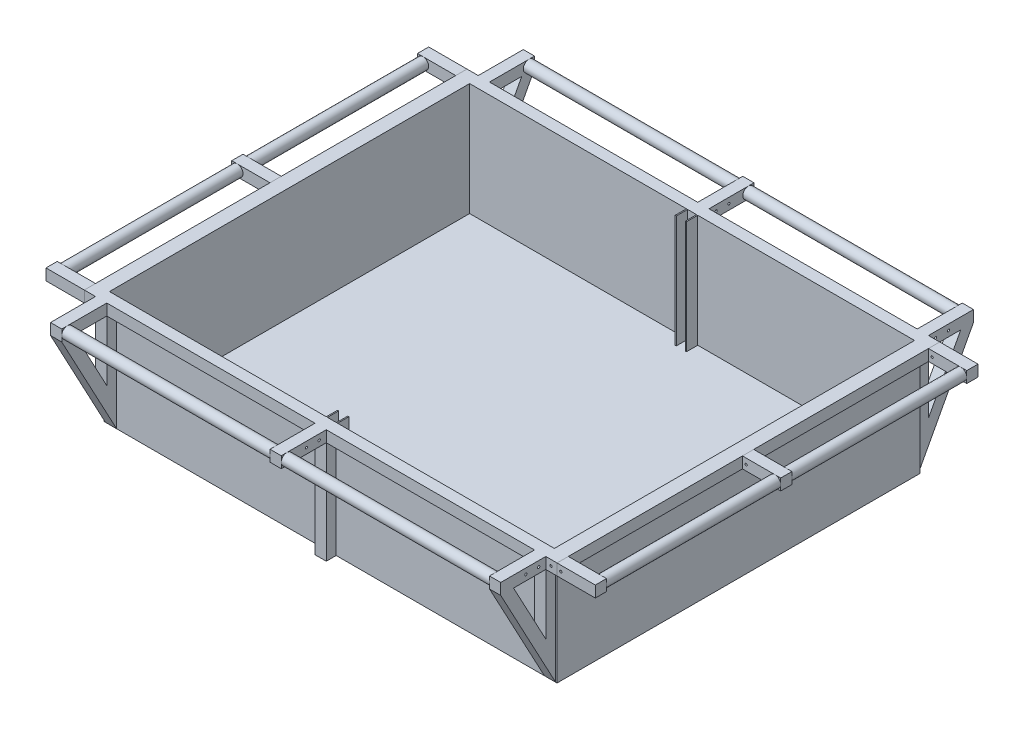
from build123d import *

# Parameters (mm, degrees)
SKETCH1_W            = 1050
SKETCH1_H            = 850
BOSS_EXTRUDE2_DEPTH  = 3
SKETCH2_W            = 1050
SKETCH2_H            = 850
SKETCH2_W_2          = 988.235294118
SKETCH2_H_2          = 800
BOSS_EXTRUDE4_DEPTH  = 250
SKETCH3_W            = 1050
SKETCH3_H            = 850
SKETCH3_W_2          = 1006
SKETCH3_H_2          = 806
CUT_EXTRUDE2_DEPTH   = 228
SKETCH6_W            = 25
SKETCH6_H            = 25
BASE_FLANGE1_DEPTH   = 85
SKETCH11_W           = 25
SKETCH11_H           = 25
BASE_FLANGE2_DEPTH   = 85
SKETCH14_W           = 25
SKETCH14_H           = 25
BASE_FLANGE3_DEPTH   = 85
SKETCH17_R           = 12.5
BASE_FLANGE5_DEPTH   = 800
SKETCH22_W           = 25
SKETCH22_H           = 25
BASE_FLANGE6_DEPTH   = 85
SKETCH25_W           = 25
SKETCH25_H           = 25
BASE_FLANGE7_DEPTH   = 85
SKETCH29_W           = 25
SKETCH29_H           = 25
BASE_FLANGE8_DEPTH   = 85
SKETCH32_R           = 12.5
BASE_FLANGE9_DEPTH   = 800
SKETCH83_W           = 25
SKETCH83_H           = 228
BOSS_EXTRUDE5_DEPTH  = 22
SKETCH85_W           = 25
SKETCH85_H           = 228
BOSS_EXTRUDE6_DEPTH  = 22
SKETCH87_W           = 25
SKETCH87_H           = 228
BOSS_EXTRUDE7_DEPTH  = 22
SKETCH88_W           = 25
SKETCH88_H           = 228
BOSS_EXTRUDE8_DEPTH  = 22
SKETCH89_W           = 25
SKETCH89_H           = 228
BOSS_EXTRUDE9_DEPTH  = 22
SKETCH90_W           = 25
SKETCH90_H           = 228
BOSS_EXTRUDE10_DEPTH = 22
SKETCH91_W           = 25
SKETCH91_H           = 25
BOSS_EXTRUDE11_DEPTH = 100
SKETCH92_W           = 25
SKETCH92_H           = 25
BOSS_EXTRUDE12_DEPTH = 100
SKETCH93_W           = 25
SKETCH93_H           = 25
BOSS_EXTRUDE13_DEPTH = 100
SKETCH94_W           = 25
SKETCH94_H           = 25
BOSS_EXTRUDE14_DEPTH = 100
SKETCH95_W           = 25
SKETCH95_H           = 25
BOSS_EXTRUDE15_DEPTH = 100
SKETCH96_W           = 25
SKETCH96_H           = 25
BOSS_EXTRUDE16_DEPTH = 100
SKETCH114_W          = 2.5
SKETCH114_H          = 250
BOSS_EXTRUDE22_DEPTH = 25
SKETCH120_W          = 2.5
SKETCH120_H          = 250
BOSS_EXTRUDE24_DEPTH = 25
RIB107_REACH         = 1255.688
SKETCH109_WALL_W     = 2767.964794142
SKETCH109_WALL_H     = 25
CUT_EXTRUDE10_DEPTH  = 30
RIB108_REACH         = 1255.688
SKETCH123_WALL_W     = 2767.964794142
SKETCH123_WALL_H     = 25
CUT_EXTRUDE12_DEPTH  = 30
CUT_EXTRUDE13_DEPTH  = 30
CUT_EXTRUDE14_DEPTH  = 30
RIB110_REACH         = 1255.688
SKETCH128_WALL_W     = 2767.964794142
SKETCH128_WALL_H     = 25
CUT_EXTRUDE15_DEPTH  = 30
CUT_EXTRUDE16_DEPTH  = 30
RIB118_REACH         = 1255.688
SKETCH134_WALL_W     = 2767.964794142
SKETCH134_WALL_H     = 25
CUT_EXTRUDE17_DEPTH  = 30
CUT_EXTRUDE18_DEPTH  = 30
SKETCH137_R          = 12.5
BOSS_EXTRUDE25_DEPTH = 950
SKETCH138_R          = 12.5
BOSS_EXTRUDE26_DEPTH = 950
SKETCH139_R          = 2.5
CUT_EXTRUDE19_DEPTH  = 550
SKETCH140_R          = 2.5
CUT_EXTRUDE21_DEPTH  = 860
LPATTERN1_COUNT      = 2
LPATTERN1_PITCH      = 910


# Sheet-metal steps are written as plain solids
with BuildPart() as part:
    # Sketch1 → Boss-Extrude2 (new body)
    with BuildSketch(Plane(origin=(0, 0, 0), x_dir=(1, 0, 0), z_dir=(0, 1, 0))):
        Rectangle(SKETCH1_W, SKETCH1_H)
    extrude(amount=BOSS_EXTRUDE2_DEPTH)

    # Sketch2 → Boss-Extrude4 (add)
    with BuildSketch(Plane(origin=(0, 3, 0), x_dir=(1, 0, 0), z_dir=(0, 1, 0))):
        Rectangle(SKETCH2_W, SKETCH2_H)
        Rectangle(SKETCH2_W_2, SKETCH2_H_2, mode=Mode.SUBTRACT)
    extrude(amount=BOSS_EXTRUDE4_DEPTH)

    # Sketch3 → Cut-Extrude2 (cut)
    with BuildSketch(Plane.XZ):
        Rectangle(SKETCH3_W, SKETCH3_H)
        Rectangle(SKETCH3_W_2, SKETCH3_H_2, mode=Mode.SUBTRACT)
    extrude(amount=-CUT_EXTRUDE2_DEPTH, mode=Mode.SUBTRACT)

    # Sketch83 → Boss-Extrude5 (add)
    with BuildSketch(Plane(origin=(0, 0, -403), x_dir=(-1, 0, 0), z_dir=(0, 0, -1))):
        with Locations((-487.5, 114)):
            Rectangle(SKETCH83_W, SKETCH83_H)
    extrude(amount=BOSS_EXTRUDE5_DEPTH)

    # Sketch85 → Boss-Extrude6 (add)
    with BuildSketch(Plane(origin=(0, 0, -403), x_dir=(-1, 0, 0), z_dir=(0, 0, -1))):
        with Locations((487.5, 114)):
            Rectangle(SKETCH85_W, SKETCH85_H)
    extrude(amount=BOSS_EXTRUDE6_DEPTH)

    # Sketch87 → Boss-Extrude7 (add)
    with BuildSketch(Plane(origin=(0, 0, -403), x_dir=(-1, 0, 0), z_dir=(0, 0, -1))):
        with Locations((0, 114)):
            Rectangle(SKETCH87_W, SKETCH87_H)
    extrude(amount=BOSS_EXTRUDE7_DEPTH)

    # Sketch88 → Boss-Extrude8 (add)
    with BuildSketch(Plane.XY.offset(403)):
        with Locations((-487.5, 114)):
            Rectangle(SKETCH88_W, SKETCH88_H)
    extrude(amount=BOSS_EXTRUDE8_DEPTH)

    # Sketch89 → Boss-Extrude9 (add)
    with BuildSketch(Plane.XY.offset(403)):
        with Locations((487.5, 114)):
            Rectangle(SKETCH89_W, SKETCH89_H)
    extrude(amount=BOSS_EXTRUDE9_DEPTH)

    # Sketch90 → Boss-Extrude10 (add)
    with BuildSketch(Plane.XY.offset(403)):
        with Locations((0, 114)):
            Rectangle(SKETCH90_W, SKETCH90_H)
    extrude(amount=BOSS_EXTRUDE10_DEPTH)

    # Sketch91 → Boss-Extrude11 (add)
    with BuildSketch(Plane.XY.offset(425)):
        with Locations((-487.5, 240.5)):
            Rectangle(SKETCH91_W, SKETCH91_H)
    extrude(amount=BOSS_EXTRUDE11_DEPTH)

    # Sketch92 → Boss-Extrude12 (add)
    with BuildSketch(Plane.XY.offset(425)):
        with Locations((0, 240.5)):
            Rectangle(SKETCH92_W, SKETCH92_H)
    extrude(amount=BOSS_EXTRUDE12_DEPTH)

    # Sketch93 → Boss-Extrude13 (add)
    with BuildSketch(Plane.XY.offset(425)):
        with Locations((487.5, 240.5)):
            Rectangle(SKETCH93_W, SKETCH93_H)
    extrude(amount=BOSS_EXTRUDE13_DEPTH)

    # Sketch94 → Boss-Extrude14 (add)
    with BuildSketch(Plane(origin=(0, 0, -425), x_dir=(-1, 0, 0), z_dir=(0, 0, -1))):
        with Locations((-487.5, 240.5)):
            Rectangle(SKETCH94_W, SKETCH94_H)
    extrude(amount=BOSS_EXTRUDE14_DEPTH)

    # Sketch95 → Boss-Extrude15 (add)
    with BuildSketch(Plane(origin=(0, 0, -425), x_dir=(-1, 0, 0), z_dir=(0, 0, -1))):
        with Locations((0, 240.5)):
            Rectangle(SKETCH95_W, SKETCH95_H)
    extrude(amount=BOSS_EXTRUDE15_DEPTH)

    # Sketch96 → Boss-Extrude16 (add)
    with BuildSketch(Plane(origin=(0, 0, -425), x_dir=(-1, 0, 0), z_dir=(0, 0, -1))):
        with Locations((487.5, 240.5)):
            Rectangle(SKETCH96_W, SKETCH96_H)
    extrude(amount=BOSS_EXTRUDE16_DEPTH)

    # Sketch114 → Boss-Extrude22 (add)
    with BuildSketch(Plane(origin=(0, 0, 400), x_dir=(-1, 0, 0), z_dir=(0, 0, -1))):
        with Locations((-11.25, 128)):
            Rectangle(SKETCH114_W, SKETCH114_H)
        with Locations((11.25, 128)):
            Rectangle(SKETCH114_W, SKETCH114_H)
    extrude(amount=BOSS_EXTRUDE22_DEPTH)

    # Sketch120 → Boss-Extrude24 (add)
    with BuildSketch(Plane.XY.offset(-400)):
        with Locations((-11.25, 128)):
            Rectangle(SKETCH120_W, SKETCH120_H)
        with Locations((11.25, 128)):
            Rectangle(SKETCH120_W, SKETCH120_H)
    extrude(amount=BOSS_EXTRUDE24_DEPTH)

    # Sketch109 wall → Rib107 (add, up to next)
    with BuildSketch(Plane(origin=(500, 114, 464), x_dir=(0, -0.881709824778, -0.471792099223), z_dir=(0, 0.471792099223, -0.881709824778)), mode=Mode.PRIVATE) as rib107_sk1:
        with Locations((0, 12.5)):
            Rectangle(SKETCH109_WALL_W, SKETCH109_WALL_H)
    rib107_tool1 = extrude(rib107_sk1.sketch, amount=RIB107_REACH, mode=Mode.PRIVATE) - part.part
    add(rib107_tool1.solids().sort_by_distance((500, 114, 464))[0])

    # Sketch121 → Cut-Extrude10 (cut)
    with BuildSketch(Plane(origin=(500, 0, 0), x_dir=(0, 0, -1), z_dir=(1, 0, 0))):
        Polygon((-425, 41.114754098), (-403, 0), (-425, 0), align=None)
    extrude(amount=-CUT_EXTRUDE10_DEPTH, mode=Mode.SUBTRACT)

    # Sketch123 wall → Rib108 (add, up to next)
    with BuildSketch(Plane(origin=(-500, 114, 464), x_dir=(0, -0.881709824778, -0.471792099223), z_dir=(0, -0.471792099223, 0.881709824778)), mode=Mode.PRIVATE) as rib108_sk1:
        with Locations((0, 12.5)):
            Rectangle(SKETCH123_WALL_W, SKETCH123_WALL_H)
    rib108_tool1 = extrude(rib108_sk1.sketch, amount=-RIB108_REACH, mode=Mode.PRIVATE) - part.part
    add(rib108_tool1.solids().sort_by_distance((-500, 114, 464))[0])

    # Sketch125 → Cut-Extrude12 (cut)
    with BuildSketch(Plane.ZY.offset(500)):
        Polygon((425, 41.114754098), (403, 0), (425, 0), align=None)
    extrude(amount=-CUT_EXTRUDE12_DEPTH, mode=Mode.SUBTRACT)

    # Sketch126 → Cut-Extrude13 (cut)
    with BuildSketch(Plane.ZY.offset(500)):
        Polygon((425, 228), (425, 94.104195933), (496.646000422, 228), align=None)
    extrude(amount=-CUT_EXTRUDE13_DEPTH, mode=Mode.SUBTRACT)

    # Sketch127 → Cut-Extrude14 (cut)
    with BuildSketch(Plane(origin=(500, 0, 0), x_dir=(0, 0, -1), z_dir=(1, 0, 0))):
        Polygon((-425, 228), (-496.646000422, 228), (-425, 94.104195933), align=None)
    extrude(amount=-CUT_EXTRUDE14_DEPTH, mode=Mode.SUBTRACT)

    # Sketch128 wall → Rib110 (add, up to next)
    with BuildSketch(Plane(origin=(500, 114, -464), x_dir=(0, -0.881709824778, 0.471792099223), z_dir=(0, -0.471792099223, -0.881709824778)), mode=Mode.PRIVATE) as rib110_sk1:
        with Locations((0, 12.5)):
            Rectangle(SKETCH128_WALL_W, SKETCH128_WALL_H)
    rib110_tool1 = extrude(rib110_sk1.sketch, amount=-RIB110_REACH, mode=Mode.PRIVATE) - part.part
    add(rib110_tool1.solids().sort_by_distance((500, 114, -464))[0])

    # Sketch129 → Cut-Extrude15 (cut)
    with BuildSketch(Plane(origin=(500, 0, 0), x_dir=(0, 0, -1), z_dir=(1, 0, 0))):
        Polygon((425, 41.114754098), (403, 0), (425, 0), align=None)
    extrude(amount=-CUT_EXTRUDE15_DEPTH, mode=Mode.SUBTRACT)

    # Sketch130 → Cut-Extrude16 (cut)
    with BuildSketch(Plane(origin=(500, 0, 0), x_dir=(0, 0, -1), z_dir=(1, 0, 0))):
        Polygon((425, 228), (425, 94.104195933), (496.646000422, 228), align=None)
    extrude(amount=-CUT_EXTRUDE16_DEPTH, mode=Mode.SUBTRACT)

    # Sketch134 wall → Rib118 (add, up to next)
    with BuildSketch(Plane(origin=(-500, 114, -464), x_dir=(0, -0.881709824778, 0.471792099223), z_dir=(0, 0.471792099223, 0.881709824778)), mode=Mode.PRIVATE) as rib118_sk1:
        with Locations((0, 12.5)):
            Rectangle(SKETCH134_WALL_W, SKETCH134_WALL_H)
    rib118_tool1 = extrude(rib118_sk1.sketch, amount=RIB118_REACH, mode=Mode.PRIVATE) - part.part
    add(rib118_tool1.solids().sort_by_distance((-500, 114, -464))[0])

    # Sketch135 → Cut-Extrude17 (cut)
    with BuildSketch(Plane.ZY.offset(500)):
        Polygon((-425, 41.114754098), (-425, 0), (-403, 0), align=None)
    extrude(amount=-CUT_EXTRUDE17_DEPTH, mode=Mode.SUBTRACT)

    # Sketch136 → Cut-Extrude18 (cut)
    with BuildSketch(Plane.ZY.offset(500)):
        Polygon((-425, 228), (-496.646000422, 228), (-425, 94.104195933), align=None)
    extrude(amount=-CUT_EXTRUDE18_DEPTH, mode=Mode.SUBTRACT)

    # Sketch137 → Boss-Extrude25 (add)
    with BuildSketch(Plane.ZY.offset(-475)):
        with Locations(Location((-512.5, 240.5, 0), (0, 0, 180))):
            Circle(SKETCH137_R)
    extrude(amount=BOSS_EXTRUDE25_DEPTH)

    # Sketch138 → Boss-Extrude26 (add)
    with BuildSketch(Plane(origin=(-475, 0, 0), x_dir=(0, 0, -1), z_dir=(1, 0, 0))):
        with Locations(Location((-512.5, 240.5, 0), (0, 0, 180))):
            Circle(SKETCH138_R)
    extrude(amount=BOSS_EXTRUDE26_DEPTH)

    # Sketch139 → Cut-Extrude19 (cut)
    with BuildSketch(Plane(origin=(500, 0, 0), x_dir=(0, 0, -1), z_dir=(1, 0, 0))):
        with Locations(Location((440.8, 240.5, 0), (0, 0, 90))):
            Circle(SKETCH139_R)
        with Locations(Location((469.3, 240.5, 0), (0, 0, 90))):
            Circle(SKETCH139_R)
    cut_extrude19 = extrude(amount=-CUT_EXTRUDE19_DEPTH, mode=Mode.SUBTRACT)


with BuildPart() as body_2:
    # Sketch6 → Base-Flange1 (new body)
    with BuildSketch(Plane(origin=(525, 0, 0), x_dir=(0, 0, -1), z_dir=(1, 0, 0))):
        with Locations((-412.5, 240.5)):
            Rectangle(SKETCH6_W, SKETCH6_H)
    extrude(amount=BASE_FLANGE1_DEPTH)


with BuildPart() as body_3:
    # Sketch11 → Base-Flange2 (new body)
    with BuildSketch(Plane(origin=(525, 0, 0), x_dir=(0, 0, -1), z_dir=(1, 0, 0))):
        with Locations((412.5, 240.5)):
            Rectangle(SKETCH11_W, SKETCH11_H)
    extrude(amount=BASE_FLANGE2_DEPTH)


with BuildPart() as body_4:
    # Sketch14 → Base-Flange3 (new body)
    with BuildSketch(Plane(origin=(525, 0, 0), x_dir=(0, 0, -1), z_dir=(1, 0, 0))):
        with Locations((-0.707172723, 240.5)):
            Rectangle(SKETCH14_W, SKETCH14_H)
    extrude(amount=BASE_FLANGE3_DEPTH)


with BuildPart() as body_5:
    # Sketch17 → Base-Flange5 (new body)
    with BuildSketch(Plane(origin=(0, 0, 400), x_dir=(-1, 0, 0), z_dir=(0, 0, -1))):
        with Locations(Location((-597.5, 240.5, 0), (0, 0, 90))):
            Circle(SKETCH17_R)
    extrude(amount=BASE_FLANGE5_DEPTH)


with BuildPart() as body_6:
    # Sketch22 → Base-Flange6 (new body)
    with BuildSketch(Plane.ZY.offset(525)):
        with Locations((-412.5, 240.5)):
            Rectangle(SKETCH22_W, SKETCH22_H)
    extrude(amount=BASE_FLANGE6_DEPTH)


with BuildPart() as body_7:
    # Sketch25 → Base-Flange7 (new body)
    with BuildSketch(Plane.ZY.offset(525)):
        with Locations((412.5, 240.5)):
            Rectangle(SKETCH25_W, SKETCH25_H)
    extrude(amount=BASE_FLANGE7_DEPTH)


with BuildPart() as body_8:
    # Sketch29 → Base-Flange8 (new body)
    with BuildSketch(Plane.ZY.offset(525)):
        with Locations((0, 240.5)):
            Rectangle(SKETCH29_W, SKETCH29_H)
    extrude(amount=BASE_FLANGE8_DEPTH)


with BuildPart() as body_9:
    # Sketch32 → Base-Flange9 (new body)
    with BuildSketch(Plane.XY.offset(-400)):
        with Locations((-597.5, 240.5)):
            Circle(SKETCH32_R)
    extrude(amount=BASE_FLANGE9_DEPTH)


with BuildPart() as cut_extrude21_tool:
    # Sketch140 → Cut-Extrude21 (new body)
    with BuildSketch(Plane(origin=(0, 0, -425), x_dir=(-1, 0, 0), z_dir=(0, 0, -1))):
        with Locations((-511.7, 240.5)):
            Circle(SKETCH140_R)
        with Locations((-533.3, 240.5)):
            Circle(SKETCH140_R)
    extrude(amount=-CUT_EXTRUDE21_DEPTH)


with BuildPart() as part_1:
    add(part.part)

    # Cut-Extrude21: cut by cut_extrude21_tool
    add(cut_extrude21_tool.part, mode=Mode.SUBTRACT)

    # LPattern1: Cut-Extrude19 ×2
    with Locations(*[(0, 0, i * LPATTERN1_PITCH) for i in range(1, LPATTERN1_COUNT)]):
        add(cut_extrude19, mode=Mode.SUBTRACT)


with BuildPart() as body_2_1:
    add(body_2.part)

    # Cut-Extrude21: cut by cut_extrude21_tool
    add(cut_extrude21_tool.part, mode=Mode.SUBTRACT)


with BuildPart() as body_3_1:
    add(body_3.part)

    # Cut-Extrude21: cut by cut_extrude21_tool
    add(cut_extrude21_tool.part, mode=Mode.SUBTRACT)


with BuildPart() as body_4_1:
    add(body_4.part)

    # Cut-Extrude21: cut by cut_extrude21_tool
    add(cut_extrude21_tool.part, mode=Mode.SUBTRACT)


solid = Compound([body_5.part, body_6.part, body_7.part, body_8.part, body_9.part, part_1.part, body_2_1.part, body_3_1.part, body_4_1.part])
